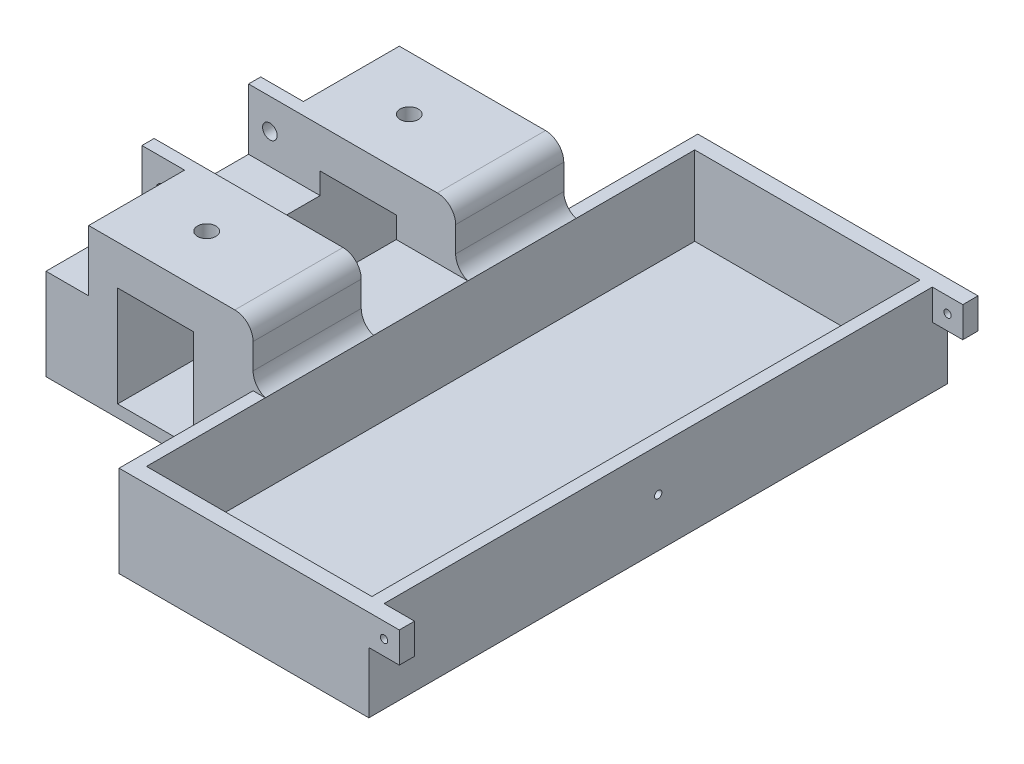
from build123d import *

# Parameters (mm, degrees)
SKETCH1_W           = 75
SKETCH1_H           = 95
BOSS_EXTRUDE1_DEPTH = 15
SKETCH2_W           = 95
SKETCH2_H           = 5
BOSS_EXTRUDE2_DEPTH = 5
SKETCH3_R           = 0.6
CUT_EXTRUDE1_DEPTH  = 100
SKETCH4_W           = 5
SKETCH4_H           = 90
CUT_EXTRUDE2_DEPTH  = 100
SKETCH5_W           = 34
SKETCH5_H           = 15
CUT_EXTRUDE3_DEPTH  = 22
SKETCH6_W           = 34
SKETCH6_H           = 15
CUT_EXTRUDE4_DEPTH  = 22
SKETCH7_W           = 37
SKETCH7_H           = 90
CUT_EXTRUDE5_DEPTH  = 13
SKETCH10_W          = 34
SKETCH10_H          = 51
BOSS_EXTRUDE3_DEPTH = 10
SKETCH11_W          = 12.5
SKETCH11_H          = 16.5
CUT_EXTRUDE6_DEPTH  = 100
SKETCH12_W          = 15.5
SKETCH12_H          = 10
CUT_EXTRUDE8_DEPTH  = 100
SKETCH13_W          = 15.75
SKETCH13_H          = 10
CUT_EXTRUDE9_DEPTH  = 7
SKETCH14_W          = 15.75
SKETCH14_H          = 10
CUT_EXTRUDE10_DEPTH = 7
SKETCH15_R          = 1.2
CUT_EXTRUDE11_DEPTH = 100
SKETCH16_R          = 1.2
SKETCH16_W          = 5
SKETCH16_H          = 10
CUT_EXTRUDE12_DEPTH = 100
SKETCH17_R          = 1.5
CUT_EXTRUDE14_DEPTH = 10
FILLET3_R           = 3
FILLET4_R           = 3
SKETCH19_R          = 0.6
CUT_EXTRUDE15_DEPTH = 10


with BuildPart() as part:
    # Sketch1 → Boss-Extrude1 (new body)
    with BuildSketch(Plane(origin=(0, 0, 0), x_dir=(1, 0, 0), z_dir=(0, 1, 0))):
        Rectangle(SKETCH1_W, SKETCH1_H)
    extrude(amount=BOSS_EXTRUDE1_DEPTH)

    # Sketch2 → Boss-Extrude2 (add)
    with BuildSketch(Plane(origin=(37.5, 0, 0), x_dir=(0, 0, -1), z_dir=(1, 0, 0))):
        with Locations((0, 12.5)):
            Rectangle(SKETCH2_W, SKETCH2_H)
    extrude(amount=BOSS_EXTRUDE2_DEPTH)

    # Sketch3 → Cut-Extrude1 (cut)
    with BuildSketch(Plane(origin=(0, 0, -47.5), x_dir=(-1, 0, 0), z_dir=(0, 0, -1))):
        with Locations((-40, 12.458610353)):
            Circle(SKETCH3_R)
    extrude(amount=-CUT_EXTRUDE1_DEPTH, mode=Mode.SUBTRACT)

    # Sketch4 → Cut-Extrude2 (cut)
    with BuildSketch(Plane(origin=(0, 15, 0), x_dir=(1, 0, 0), z_dir=(0, 1, 0))):
        with Locations((40, 0)):
            Rectangle(SKETCH4_W, SKETCH4_H)
    extrude(amount=-CUT_EXTRUDE2_DEPTH, mode=Mode.SUBTRACT)

    # Sketch5 → Cut-Extrude3 (cut)
    with BuildSketch(Plane(origin=(0, 0, -47.5), x_dir=(-1, 0, 0), z_dir=(0, 0, -1))):
        with Locations((20.5, 7.5)):
            Rectangle(SKETCH5_W, SKETCH5_H)
    extrude(amount=-CUT_EXTRUDE3_DEPTH, mode=Mode.SUBTRACT)

    # Sketch6 → Cut-Extrude4 (cut)
    with BuildSketch(Plane.XY.offset(47.5)):
        with Locations((-20.5, 7.5)):
            Rectangle(SKETCH6_W, SKETCH6_H)
    extrude(amount=-CUT_EXTRUDE4_DEPTH, mode=Mode.SUBTRACT)

    # Sketch7 → Cut-Extrude5 (cut)
    with BuildSketch(Plane(origin=(0, 15, 0), x_dir=(1, 0, 0), z_dir=(0, 1, 0))):
        with Locations((17, 0)):
            Rectangle(SKETCH7_W, SKETCH7_H)
    extrude(amount=-CUT_EXTRUDE5_DEPTH, mode=Mode.SUBTRACT)

    # Sketch10 → Boss-Extrude3 (add)
    with BuildSketch(Plane(origin=(0, 15, 0), x_dir=(1, 0, 0), z_dir=(0, 1, 0))):
        with Locations((-20.5, 0)):
            Rectangle(SKETCH10_W, SKETCH10_H)
    extrude(amount=BOSS_EXTRUDE3_DEPTH)

    # Sketch11 → Cut-Extrude6 (cut)
    with BuildSketch(Plane.XY.offset(25.5)):
        with Locations((-19.5, 10.25)):
            Rectangle(SKETCH11_W, SKETCH11_H)
    extrude(amount=-CUT_EXTRUDE6_DEPTH, mode=Mode.SUBTRACT)

    # Sketch12 → Cut-Extrude8 (cut)
    with BuildSketch(Plane.ZY.offset(37.5)):
        with Locations((0, 20)):
            Rectangle(SKETCH12_W, SKETCH12_H)
    extrude(amount=-CUT_EXTRUDE8_DEPTH, mode=Mode.SUBTRACT)

    # Sketch13 → Cut-Extrude9 (cut)
    with BuildSketch(Plane.ZY.offset(37.5)):
        with Locations((-17.625, 20)):
            Rectangle(SKETCH13_W, SKETCH13_H)
    extrude(amount=-CUT_EXTRUDE9_DEPTH, mode=Mode.SUBTRACT)

    # Sketch14 → Cut-Extrude10 (cut)
    with BuildSketch(Plane.ZY.offset(37.5)):
        with Locations((17.625, 20)):
            Rectangle(SKETCH14_W, SKETCH14_H)
    extrude(amount=-CUT_EXTRUDE10_DEPTH, mode=Mode.SUBTRACT)

    # Sketch15 → Cut-Extrude11 (cut)
    with BuildSketch(Plane.XY.offset(9.75)):
        with Locations((-34, 20)):
            Circle(SKETCH15_R)
    extrude(amount=-CUT_EXTRUDE11_DEPTH, mode=Mode.SUBTRACT)

    # Sketch16 → Cut-Extrude12 (cut)
    with BuildSketch(Plane(origin=(0, 2, 0), x_dir=(1, 0, 0), z_dir=(0, 1, 0))):
        with Locations(Location((31, 30, 0), (0, 0, 270))):
            Circle(SKETCH16_R)
        with Locations(Location((31, -30, 0), (0, 0, 270))):
            Circle(SKETCH16_R)
        with Locations((31, -38)):
            Rectangle(SKETCH16_W, SKETCH16_H)
        with Locations((31, 38)):
            Rectangle(SKETCH16_W, SKETCH16_H)
    extrude(amount=-CUT_EXTRUDE12_DEPTH, mode=Mode.SUBTRACT)

    # Sketch17 → Cut-Extrude14 (cut)
    with BuildSketch(Plane(origin=(0, 25, 0), x_dir=(1, 0, 0), z_dir=(0, 1, 0))):
        with Locations(Location((-20, -16.625, 0), (0, 0, 270))):
            Circle(SKETCH17_R)
        with Locations(Location((-20, 16.625, 0), (0, 0, 270))):
            Circle(SKETCH17_R)
    extrude(amount=-CUT_EXTRUDE14_DEPTH, mode=Mode.SUBTRACT)

    # Fillet3
    # the kernel refuses this fillet: 3 mm, written as the material it adds along each edge
    with BuildSketch(Plane(origin=(-3.5, 15, -25.5), x_dir=(1, 0, 0), z_dir=(0, 0, 1))) as fillet3_piece_1:
        with BuildLine():
            CenterArc((3, 2.828427125), FILLET3_R, 180, 70.528779366)
            Line((0, 2.828427125), (0, 0))
            Line((0, 0), (2, 0))
        make_face()
    extrude(amount=17.75)
    # the kernel refuses this fillet: 3 mm, written as the material it takes off along each edge
    with BuildSketch(Plane(origin=(-3.5, 25, -33), x_dir=(-1, 0, 0), z_dir=(0, 0, 1))) as fillet3_2_piece_1:
        with BuildLine():
            CenterArc((FILLET3_R, FILLET3_R), FILLET3_R, 180, 90)
            Line((0, FILLET3_R), (0, 0))
            Line((0, 0), (FILLET3_R, 0))
        make_face()
    extrude(amount=32.75, mode=Mode.SUBTRACT)

    # Fillet4
    # the kernel refuses this fillet: 3 mm, written as the material it adds along each edge
    with BuildSketch(Plane(origin=(-3.5, 15, 7.75), x_dir=(1, 0, 0), z_dir=(0, 0, 1))) as fillet4_piece_1:
        with BuildLine():
            CenterArc((3, 2.828427125), FILLET4_R, 180, 70.528779366)
            Line((0, 2.828427125), (0, 0))
            Line((0, 0), (2, 0))
        make_face()
    extrude(amount=17.75)
    # the kernel refuses this fillet: 3 mm, written as the material it takes off along each edge
    with BuildSketch(Plane(origin=(-3.5, 25, 0.25), x_dir=(-1, 0, 0), z_dir=(0, 0, 1))) as fillet4_2_piece_1:
        with BuildLine():
            CenterArc((FILLET4_R, FILLET4_R), FILLET4_R, 180, 90)
            Line((0, FILLET4_R), (0, 0))
            Line((0, 0), (FILLET4_R, 0))
        make_face()
    extrude(amount=32.75, mode=Mode.SUBTRACT)

    # Sketch19 → Cut-Extrude15 (cut)
    with BuildSketch(Plane(origin=(37.5, 0, 0), x_dir=(0, 0, -1), z_dir=(1, 0, 0))):
        with Locations((0, 8)):
            Circle(SKETCH19_R)
    extrude(amount=-CUT_EXTRUDE15_DEPTH, mode=Mode.SUBTRACT)


solid = part.part
